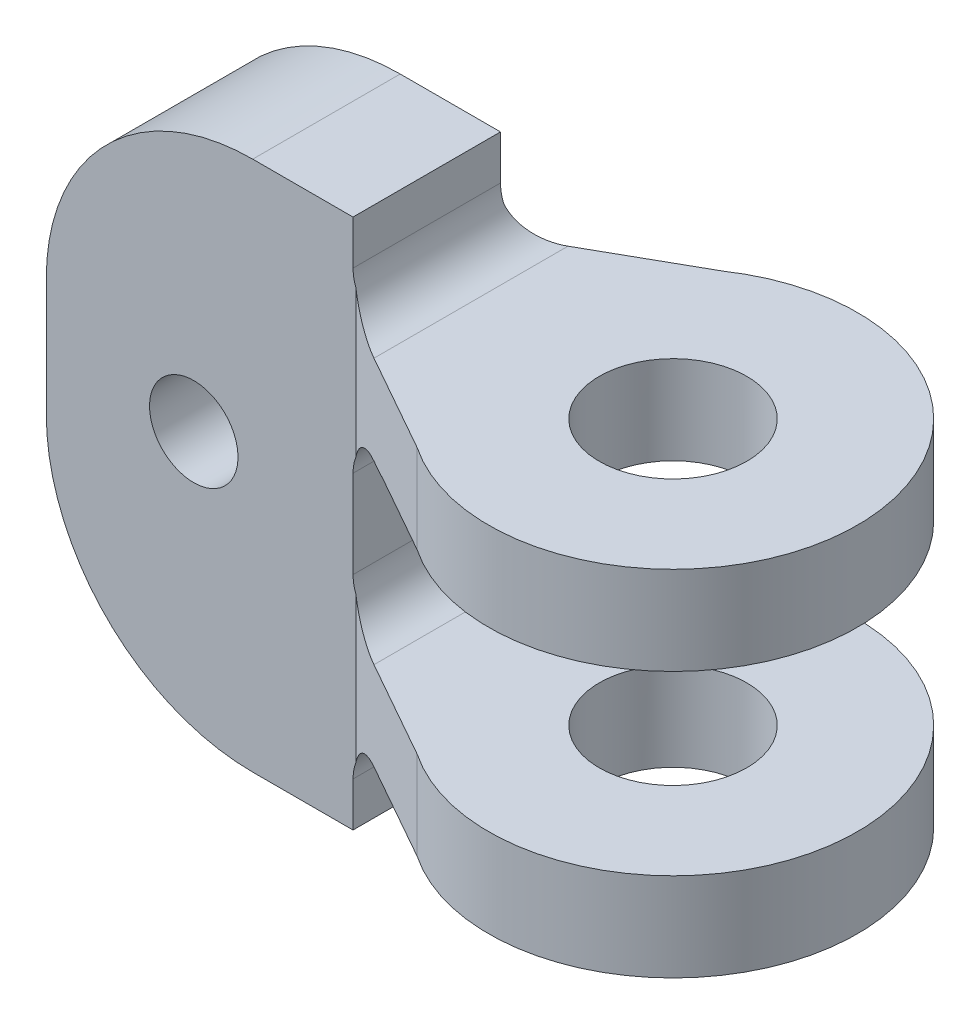
from build123d import *
from build123d.topology import SkipClean

# Parameters (mm, degrees)
CROQUIS1_R              = 1.5
SALIENTE_EXTRUIR1_DEPTH = 15
CROQUIS2_R              = 2.5
CORTAR_EXTRUIR1_DEPTH   = 20
CORTAR_EXTRUIR2_START   = -26
CORTAR_EXTRUIR2_DEPTH   = 26
CROQUIS5_W              = 3.971897385
CROQUIS5_H              = 3.395681121
CROQUIS5_W_2            = 4.283880282
CROQUIS5_H_2            = 5.977747231
CROQUIS5_W_3            = 4.50146752
CROQUIS5_H_3            = 3.991827506
CORTAR_EXTRUIR5_DEPTH   = 10
REDONDEO1_R             = 1.5


with BuildPart() as part:
    # Croquis1 → Saliente-Extruir1 (new body)
    with BuildSketch(Plane.XY):
        with BuildLine():
            Line((11.25, 17.1), (11.25, 14.1))
            Line((11.25, 14.1), (23.75, 14.1))
            Line((23.75, 14.1), (23.75, 11.1))
            Line((23.75, 11.1), (11.25, 11.1))
            Line((11.25, 11.1), (11.25, 5.1))
            Line((11.25, 5.1), (23.75, 5.1))
            Line((23.75, 5.1), (23.75, 2.1))
            Line((23.75, 2.1), (11.25, 2.1))
            Line((11.25, 2.1), (11.25, -0.9))
            Line((11.25, -0.9), (5.75, -0.9))
            ThreePointArc((5.75, -0.9), (0.800252532, 1.150252532), (-1.25, 6.1))
            Line((-1.25, 6.1), (-1.25, 10.1))
            ThreePointArc((-1.25, 10.1), (0.800252532, 15.049747468), (5.75, 17.1))
            Line((5.75, 17.1), (11.25, 17.1))
        make_face()
        with Locations((3.75, 8.1)):
            Circle(CROQUIS1_R, mode=Mode.SUBTRACT)
    extrude(amount=SALIENTE_EXTRUIR1_DEPTH)

    # Croquis2 → Cortar-Extruir1 (cut)
    with BuildSketch(Plane(origin=(0, 0, 0), x_dir=(1, 0, 0), z_dir=(0, 1, 0))):
        with Locations((17.5, -7.5)):
            Circle(CROQUIS2_R)
        with BuildLine():
            Line((17.5, -1.25), (11.25, 0))
            Line((11.25, 0), (11.126279301, 1.868603497))
            Line((11.126279301, 1.868603497), (29.663453957, 1.868603497))
            Line((29.663453957, 1.868603497), (29.663453957, -17.961269996))
            Line((29.663453957, -17.961269996), (11.25, -17.961269996))
            Line((11.25, -17.961269996), (11.25, -15))
            Line((11.25, -15), (17.5, -13.75))
            ThreePointArc((17.5, -13.75), (23.75, -7.5), (17.5, -1.25))
        make_face()
    extrude(amount=CORTAR_EXTRUIR1_DEPTH, mode=Mode.SUBTRACT)

    # Croquis4 → Cortar-Extruir2 (cut)
    with SkipClean():  # the faces are left unmerged after this step: merging them gives an invalid solid
        with BuildSketch(Plane(origin=(0, 17.1, 0), x_dir=(1, 0, 0), z_dir=(0, 1, 0)).offset(CORTAR_EXTRUIR2_START)):
            with BuildLine():
                Line((-4.389645589, -10), (9.25, -10))
                Line((9.25, -10), (14.007302121, -12.683006997))
                ThreePointArc((14.007302121, -12.683006997), (15.673978879, -13.477302641), (17.5, -13.75))
                Line((17.5, -13.75), (17.5, -16.45653889))
                Line((17.5, -16.45653889), (-4.389645589, -16.45653889))
                Line((-4.389645589, -16.45653889), (-4.389645589, -10))
            make_face()
            with BuildLine():
                Line((9.25, -5), (14.007302121, -2.316993003))
                ThreePointArc((14.007302121, -2.316993003), (15.673978879, -1.522697359), (17.5, -1.25))
                Line((17.5, -1.25), (17.5, 1.887707064))
                Line((17.5, 1.887707064), (-4.389645589, 1.887707064))
                Line((-4.389645589, 1.887707064), (-4.389645589, -5))
                Line((-4.389645589, -5), (9.25, -5))
            make_face()
        extrude(amount=CORTAR_EXTRUIR2_DEPTH, mode=Mode.SUBTRACT)

    # Croquis5 → Cortar-Extruir5 (cut, symmetric)
    with SkipClean():  # the faces are left unmerged after this step: merging them gives an invalid solid
        with BuildSketch(Plane.XY.offset(10)):
            with Locations((11.135948693, 15.797840561)):
                Rectangle(CROQUIS5_W, CROQUIS5_H)
            with Locations((11.291940141, 8.088873616)):
                Rectangle(CROQUIS5_W_2, CROQUIS5_H_2)
            with Locations((11.40073376, 0.104086247)):
                Rectangle(CROQUIS5_W_3, CROQUIS5_H_3)
        extrude(amount=CORTAR_EXTRUIR5_DEPTH, both=True, mode=Mode.SUBTRACT)

    # Redondeo1
    # the kernel refuses this fillet: 1.5 mm, written as the material it adds along each edge
    with BuildSketch(Plane(origin=(9.15, 2.1, 1.25), x_dir=(0, -1, 0), z_dir=(0, 0, 1))) as redondeo1_piece_1_section:
        with BuildLine():
            CenterArc((REDONDEO1_R, REDONDEO1_R), REDONDEO1_R, 180, 90)
            Line((0, REDONDEO1_R), (0, 0))
            Line((0, 0), (REDONDEO1_R, 0))
        make_face()
    redondeo1_piece_1 = extrude(amount=8.75, mode=Mode.PRIVATE)
    redondeo1_piece_1 = split(redondeo1_piece_1, bisect_by=Plane(origin=(9.866987005, 1.973706672, 5), z_dir=(0, 0, -1)), keep=Keep.TOP, mode=Mode.PRIVATE)
    redondeo1_piece_1 = split(redondeo1_piece_1, bisect_by=Plane(origin=(9.792542983, 1.973706672, 4.694018462), z_dir=(0.4912379413342998, 0, 0.8710254215541813)), keep=Keep.TOP, mode=Mode.PRIVATE)
    add(redondeo1_piece_1)
    with BuildSketch(Plane(origin=(9.15, 2.1, 5), x_dir=(0, -1, 0), z_dir=(0, 0, 1))) as redondeo1_piece_2_section:
        with BuildLine():
            CenterArc((REDONDEO1_R, REDONDEO1_R), REDONDEO1_R, 180, 90)
            Line((0, REDONDEO1_R), (0, 0))
            Line((0, 0), (REDONDEO1_R, 0))
        make_face()
    redondeo1_piece_2 = extrude(amount=5, mode=Mode.PRIVATE)
    redondeo1_piece_2 = split(redondeo1_piece_2, bisect_by=Plane(origin=(9.170520701, 1.440228568, 5.044824463), z_dir=(-0.4912379413342998, 0, -0.8710254215541813)), keep=Keep.TOP, mode=Mode.PRIVATE)
    add(redondeo1_piece_2)
    with BuildSketch(Plane(origin=(9.15, 2.1, 5), x_dir=(0, -1, 0), z_dir=(0, 0, 1))) as redondeo1_piece_3_section:
        with BuildLine():
            CenterArc((REDONDEO1_R, REDONDEO1_R), REDONDEO1_R, 180, 90)
            Line((0, REDONDEO1_R), (0, 0))
            Line((0, 0), (REDONDEO1_R, 0))
        make_face()
    redondeo1_piece_3 = extrude(amount=5, mode=Mode.PRIVATE)
    redondeo1_piece_3 = split(redondeo1_piece_3, bisect_by=Plane(origin=(8.363208573, 1.761858884, 5.500129599), z_dir=(0.4912379413342998, 0, 0.8710254215541813)), keep=Keep.TOP, mode=Mode.PRIVATE)
    redondeo1_piece_3 = split(redondeo1_piece_3, bisect_by=Plane(origin=(8.363208573, 1.761858884, 9.499870401), z_dir=(0.4912379413342999, 0, -0.8710254215541812)), keep=Keep.TOP, mode=Mode.PRIVATE)
    add(redondeo1_piece_3)
    with BuildSketch(Plane(origin=(9.15, 2.1, 5), x_dir=(0, -1, 0), z_dir=(0, 0, 1))) as redondeo1_piece_4_section:
        with BuildLine():
            CenterArc((REDONDEO1_R, REDONDEO1_R), REDONDEO1_R, 180, 90)
            Line((0, REDONDEO1_R), (0, 0))
            Line((0, 0), (REDONDEO1_R, 0))
        make_face()
    redondeo1_piece_4 = extrude(amount=8.75, mode=Mode.PRIVATE)
    redondeo1_piece_4 = split(redondeo1_piece_4, bisect_by=Plane(origin=(9.866987005, 1.973706672, 10), z_dir=(0, 0, 1)), keep=Keep.TOP, mode=Mode.PRIVATE)
    redondeo1_piece_4 = split(redondeo1_piece_4, bisect_by=Plane(origin=(9.792542983, 1.973706672, 10.305981538), z_dir=(0.4912379413342999, 0, -0.8710254215541812)), keep=Keep.TOP, mode=Mode.PRIVATE)
    add(redondeo1_piece_4)
    with BuildSketch(Plane(origin=(9.15, 2.1, 5), x_dir=(0, -1, 0), z_dir=(0, 0, 1))) as redondeo1_piece_5_section:
        with BuildLine():
            CenterArc((REDONDEO1_R, REDONDEO1_R), REDONDEO1_R, 180, 90)
            Line((0, REDONDEO1_R), (0, 0))
            Line((0, 0), (REDONDEO1_R, 0))
        make_face()
    redondeo1_piece_5 = extrude(amount=5, mode=Mode.PRIVATE)
    redondeo1_piece_5 = split(redondeo1_piece_5, bisect_by=Plane(origin=(9.170520701, 1.440228568, 9.955175537), z_dir=(-0.4912379413342999, 0, 0.8710254215541812)), keep=Keep.TOP, mode=Mode.PRIVATE)
    add(redondeo1_piece_5)
    with BuildSketch(Plane(origin=(9.15, 5.1, 10), x_dir=(1, 0, 0), z_dir=(0, 0, -1))) as redondeo1_piece_6_section:
        with BuildLine():
            CenterArc((REDONDEO1_R, -REDONDEO1_R), REDONDEO1_R, 90, 90)
            Line((0, -REDONDEO1_R), (0, 0))
            Line((0, 0), (REDONDEO1_R, 0))
        make_face()
    redondeo1_piece_6 = extrude(amount=5, mode=Mode.PRIVATE)
    redondeo1_piece_6 = split(redondeo1_piece_6, bisect_by=Plane(origin=(9.170520704, 5.759771469, 9.955175538), z_dir=(-0.4912379413342999, 0, 0.8710254215541812)), keep=Keep.TOP, mode=Mode.PRIVATE)
    add(redondeo1_piece_6)
    with BuildSketch(Plane(origin=(9.15, 5.1, 13.75), x_dir=(1, 0, 0), z_dir=(0, 0, -1))) as redondeo1_piece_7_section:
        with BuildLine():
            CenterArc((REDONDEO1_R, -REDONDEO1_R), REDONDEO1_R, 90, 90)
            Line((0, -REDONDEO1_R), (0, 0))
            Line((0, 0), (REDONDEO1_R, 0))
        make_face()
    redondeo1_piece_7 = extrude(amount=8.75, mode=Mode.PRIVATE)
    redondeo1_piece_7 = split(redondeo1_piece_7, bisect_by=Plane(origin=(9.866987013, 5.226293308, 10), z_dir=(0, 0, 1)), keep=Keep.TOP, mode=Mode.PRIVATE)
    redondeo1_piece_7 = split(redondeo1_piece_7, bisect_by=Plane(origin=(9.792542992, 5.226293308, 10.305981543), z_dir=(0.4912379413342999, 0, -0.8710254215541812)), keep=Keep.TOP, mode=Mode.PRIVATE)
    add(redondeo1_piece_7)
    with BuildSketch(Plane(origin=(9.15, 5.1, 10), x_dir=(1, 0, 0), z_dir=(0, 0, -1))) as redondeo1_piece_8_section:
        with BuildLine():
            CenterArc((REDONDEO1_R, -REDONDEO1_R), REDONDEO1_R, 90, 90)
            Line((0, -REDONDEO1_R), (0, 0))
            Line((0, 0), (REDONDEO1_R, 0))
        make_face()
    redondeo1_piece_8 = extrude(amount=5, mode=Mode.PRIVATE)
    redondeo1_piece_8 = split(redondeo1_piece_8, bisect_by=Plane(origin=(8.363208574, 5.438141117, 5.500129598), z_dir=(0.4912379413342998, 0, 0.8710254215541813)), keep=Keep.TOP, mode=Mode.PRIVATE)
    redondeo1_piece_8 = split(redondeo1_piece_8, bisect_by=Plane(origin=(8.363208574, 5.438141117, 9.499870402), z_dir=(0.4912379413342999, 0, -0.8710254215541812)), keep=Keep.TOP, mode=Mode.PRIVATE)
    add(redondeo1_piece_8)
    with BuildSketch(Plane(origin=(9.15, 5.1, 10), x_dir=(1, 0, 0), z_dir=(0, 0, -1))) as redondeo1_piece_9_section:
        with BuildLine():
            CenterArc((REDONDEO1_R, -REDONDEO1_R), REDONDEO1_R, 90, 90)
            Line((0, -REDONDEO1_R), (0, 0))
            Line((0, 0), (REDONDEO1_R, 0))
        make_face()
    redondeo1_piece_9 = extrude(amount=5, mode=Mode.PRIVATE)
    redondeo1_piece_9 = split(redondeo1_piece_9, bisect_by=Plane(origin=(9.170520704, 5.759771469, 5.044824462), z_dir=(-0.4912379413342998, 0, -0.8710254215541813)), keep=Keep.TOP, mode=Mode.PRIVATE)
    add(redondeo1_piece_9)
    with BuildSketch(Plane(origin=(9.15, 5.1, 10), x_dir=(1, 0, 0), z_dir=(0, 0, -1))) as redondeo1_piece_10_section:
        with BuildLine():
            CenterArc((REDONDEO1_R, -REDONDEO1_R), REDONDEO1_R, 90, 90)
            Line((0, -REDONDEO1_R), (0, 0))
            Line((0, 0), (REDONDEO1_R, 0))
        make_face()
    redondeo1_piece_10 = extrude(amount=8.75, mode=Mode.PRIVATE)
    redondeo1_piece_10 = split(redondeo1_piece_10, bisect_by=Plane(origin=(9.866987013, 5.226293308, 5), z_dir=(0, 0, -1)), keep=Keep.TOP, mode=Mode.PRIVATE)
    redondeo1_piece_10 = split(redondeo1_piece_10, bisect_by=Plane(origin=(9.792542992, 5.226293308, 4.694018457), z_dir=(0.4912379413342998, 0, 0.8710254215541813)), keep=Keep.TOP, mode=Mode.PRIVATE)
    add(redondeo1_piece_10)
    with BuildSketch(Plane(origin=(9.15, 11.077747231, 13.75), x_dir=(0, -1, 0), z_dir=(0, 0, -1))) as redondeo1_piece_11_section:
        with BuildLine():
            CenterArc((REDONDEO1_R, -REDONDEO1_R), REDONDEO1_R, 90, 90)
            Line((0, -REDONDEO1_R), (0, 0))
            Line((0, 0), (REDONDEO1_R, 0))
        make_face()
    redondeo1_piece_11 = extrude(amount=8.75, mode=Mode.PRIVATE)
    redondeo1_piece_11 = split(redondeo1_piece_11, bisect_by=Plane(origin=(9.866987005, 10.951453903, 10), z_dir=(0, 0, 1)), keep=Keep.TOP, mode=Mode.PRIVATE)
    redondeo1_piece_11 = split(redondeo1_piece_11, bisect_by=Plane(origin=(9.792542983, 10.951453903, 10.305981538), z_dir=(0.4912379413342999, 0, -0.8710254215541812)), keep=Keep.TOP, mode=Mode.PRIVATE)
    add(redondeo1_piece_11)
    with BuildSketch(Plane(origin=(9.15, 11.077747231, 10), x_dir=(0, -1, 0), z_dir=(0, 0, -1))) as redondeo1_piece_12_section:
        with BuildLine():
            CenterArc((REDONDEO1_R, -REDONDEO1_R), REDONDEO1_R, 90, 90)
            Line((0, -REDONDEO1_R), (0, 0))
            Line((0, 0), (REDONDEO1_R, 0))
        make_face()
    redondeo1_piece_12 = extrude(amount=5, mode=Mode.PRIVATE)
    redondeo1_piece_12 = split(redondeo1_piece_12, bisect_by=Plane(origin=(9.170520701, 10.417975799, 9.955175537), z_dir=(-0.4912379413342999, 0, 0.8710254215541812)), keep=Keep.TOP, mode=Mode.PRIVATE)
    add(redondeo1_piece_12)
    with BuildSketch(Plane(origin=(9.15, 11.077747231, 10), x_dir=(0, -1, 0), z_dir=(0, 0, -1))) as redondeo1_piece_13_section:
        with BuildLine():
            CenterArc((REDONDEO1_R, -REDONDEO1_R), REDONDEO1_R, 90, 90)
            Line((0, -REDONDEO1_R), (0, 0))
            Line((0, 0), (REDONDEO1_R, 0))
        make_face()
    redondeo1_piece_13 = extrude(amount=5, mode=Mode.PRIVATE)
    redondeo1_piece_13 = split(redondeo1_piece_13, bisect_by=Plane(origin=(8.363208573, 10.739606115, 9.499870401), z_dir=(0.4912379413342999, 0, -0.8710254215541812)), keep=Keep.TOP, mode=Mode.PRIVATE)
    redondeo1_piece_13 = split(redondeo1_piece_13, bisect_by=Plane(origin=(8.363208573, 10.739606115, 5.500129599), z_dir=(0.4912379413342998, 0, 0.8710254215541813)), keep=Keep.TOP, mode=Mode.PRIVATE)
    add(redondeo1_piece_13)
    with BuildSketch(Plane(origin=(9.15, 11.077747231, 10), x_dir=(0, -1, 0), z_dir=(0, 0, -1))) as redondeo1_piece_14_section:
        with BuildLine():
            CenterArc((REDONDEO1_R, -REDONDEO1_R), REDONDEO1_R, 90, 90)
            Line((0, -REDONDEO1_R), (0, 0))
            Line((0, 0), (REDONDEO1_R, 0))
        make_face()
    redondeo1_piece_14 = extrude(amount=8.75, mode=Mode.PRIVATE)
    redondeo1_piece_14 = split(redondeo1_piece_14, bisect_by=Plane(origin=(9.866987005, 10.951453903, 5), z_dir=(0, 0, -1)), keep=Keep.TOP, mode=Mode.PRIVATE)
    redondeo1_piece_14 = split(redondeo1_piece_14, bisect_by=Plane(origin=(9.792542983, 10.951453903, 4.694018462), z_dir=(0.4912379413342998, 0, 0.8710254215541813)), keep=Keep.TOP, mode=Mode.PRIVATE)
    add(redondeo1_piece_14)
    with BuildSketch(Plane(origin=(9.15, 11.077747231, 10), x_dir=(0, -1, 0), z_dir=(0, 0, -1))) as redondeo1_piece_15_section:
        with BuildLine():
            CenterArc((REDONDEO1_R, -REDONDEO1_R), REDONDEO1_R, 90, 90)
            Line((0, -REDONDEO1_R), (0, 0))
            Line((0, 0), (REDONDEO1_R, 0))
        make_face()
    redondeo1_piece_15 = extrude(amount=5, mode=Mode.PRIVATE)
    redondeo1_piece_15 = split(redondeo1_piece_15, bisect_by=Plane(origin=(9.170520701, 10.417975799, 5.044824463), z_dir=(-0.4912379413342998, 0, -0.8710254215541813)), keep=Keep.TOP, mode=Mode.PRIVATE)
    add(redondeo1_piece_15)
    with BuildSketch(Plane(origin=(9.15, 14.1, 10), x_dir=(1, 0, 0), z_dir=(0, 0, -1))) as redondeo1_piece_16_section:
        with BuildLine():
            CenterArc((REDONDEO1_R, -REDONDEO1_R), REDONDEO1_R, 90, 90)
            Line((0, -REDONDEO1_R), (0, 0))
            Line((0, 0), (REDONDEO1_R, 0))
        make_face()
    redondeo1_piece_16 = extrude(amount=5, mode=Mode.PRIVATE)
    redondeo1_piece_16 = split(redondeo1_piece_16, bisect_by=Plane(origin=(9.170520704, 14.759771469, 9.955175538), z_dir=(-0.4912379413342999, 0, 0.8710254215541812)), keep=Keep.TOP, mode=Mode.PRIVATE)
    add(redondeo1_piece_16)
    with BuildSketch(Plane(origin=(9.15, 14.1, 13.75), x_dir=(1, 0, 0), z_dir=(0, 0, -1))) as redondeo1_piece_17_section:
        with BuildLine():
            CenterArc((REDONDEO1_R, -REDONDEO1_R), REDONDEO1_R, 90, 90)
            Line((0, -REDONDEO1_R), (0, 0))
            Line((0, 0), (REDONDEO1_R, 0))
        make_face()
    redondeo1_piece_17 = extrude(amount=8.75, mode=Mode.PRIVATE)
    redondeo1_piece_17 = split(redondeo1_piece_17, bisect_by=Plane(origin=(9.866987013, 14.226293308, 10), z_dir=(0, 0, 1)), keep=Keep.TOP, mode=Mode.PRIVATE)
    redondeo1_piece_17 = split(redondeo1_piece_17, bisect_by=Plane(origin=(9.792542992, 14.226293308, 10.305981543), z_dir=(0.4912379413342999, 0, -0.8710254215541812)), keep=Keep.TOP, mode=Mode.PRIVATE)
    add(redondeo1_piece_17)
    with BuildSketch(Plane(origin=(9.15, 14.1, 10), x_dir=(1, 0, 0), z_dir=(0, 0, -1))) as redondeo1_piece_18_section:
        with BuildLine():
            CenterArc((REDONDEO1_R, -REDONDEO1_R), REDONDEO1_R, 90, 90)
            Line((0, -REDONDEO1_R), (0, 0))
            Line((0, 0), (REDONDEO1_R, 0))
        make_face()
    redondeo1_piece_18 = extrude(amount=5, mode=Mode.PRIVATE)
    redondeo1_piece_18 = split(redondeo1_piece_18, bisect_by=Plane(origin=(8.363208574, 14.438141117, 5.500129598), z_dir=(0.4912379413342998, 0, 0.8710254215541813)), keep=Keep.TOP, mode=Mode.PRIVATE)
    redondeo1_piece_18 = split(redondeo1_piece_18, bisect_by=Plane(origin=(8.363208574, 14.438141117, 9.499870402), z_dir=(0.4912379413342999, 0, -0.8710254215541812)), keep=Keep.TOP, mode=Mode.PRIVATE)
    add(redondeo1_piece_18)
    with BuildSketch(Plane(origin=(9.15, 14.1, 10), x_dir=(1, 0, 0), z_dir=(0, 0, -1))) as redondeo1_piece_19_section:
        with BuildLine():
            CenterArc((REDONDEO1_R, -REDONDEO1_R), REDONDEO1_R, 90, 90)
            Line((0, -REDONDEO1_R), (0, 0))
            Line((0, 0), (REDONDEO1_R, 0))
        make_face()
    redondeo1_piece_19 = extrude(amount=5, mode=Mode.PRIVATE)
    redondeo1_piece_19 = split(redondeo1_piece_19, bisect_by=Plane(origin=(9.170520704, 14.759771469, 5.044824462), z_dir=(-0.4912379413342998, 0, -0.8710254215541813)), keep=Keep.TOP, mode=Mode.PRIVATE)
    add(redondeo1_piece_19)
    with BuildSketch(Plane(origin=(9.15, 14.1, 10), x_dir=(1, 0, 0), z_dir=(0, 0, -1))) as redondeo1_piece_20_section:
        with BuildLine():
            CenterArc((REDONDEO1_R, -REDONDEO1_R), REDONDEO1_R, 90, 90)
            Line((0, -REDONDEO1_R), (0, 0))
            Line((0, 0), (REDONDEO1_R, 0))
        make_face()
    redondeo1_piece_20 = extrude(amount=8.75, mode=Mode.PRIVATE)
    redondeo1_piece_20 = split(redondeo1_piece_20, bisect_by=Plane(origin=(9.866987013, 14.226293308, 5), z_dir=(0, 0, -1)), keep=Keep.TOP, mode=Mode.PRIVATE)
    redondeo1_piece_20 = split(redondeo1_piece_20, bisect_by=Plane(origin=(9.792542992, 14.226293308, 4.694018457), z_dir=(0.4912379413342998, 0, 0.8710254215541813)), keep=Keep.TOP, mode=Mode.PRIVATE)
    add(redondeo1_piece_20)


solid = part.part
